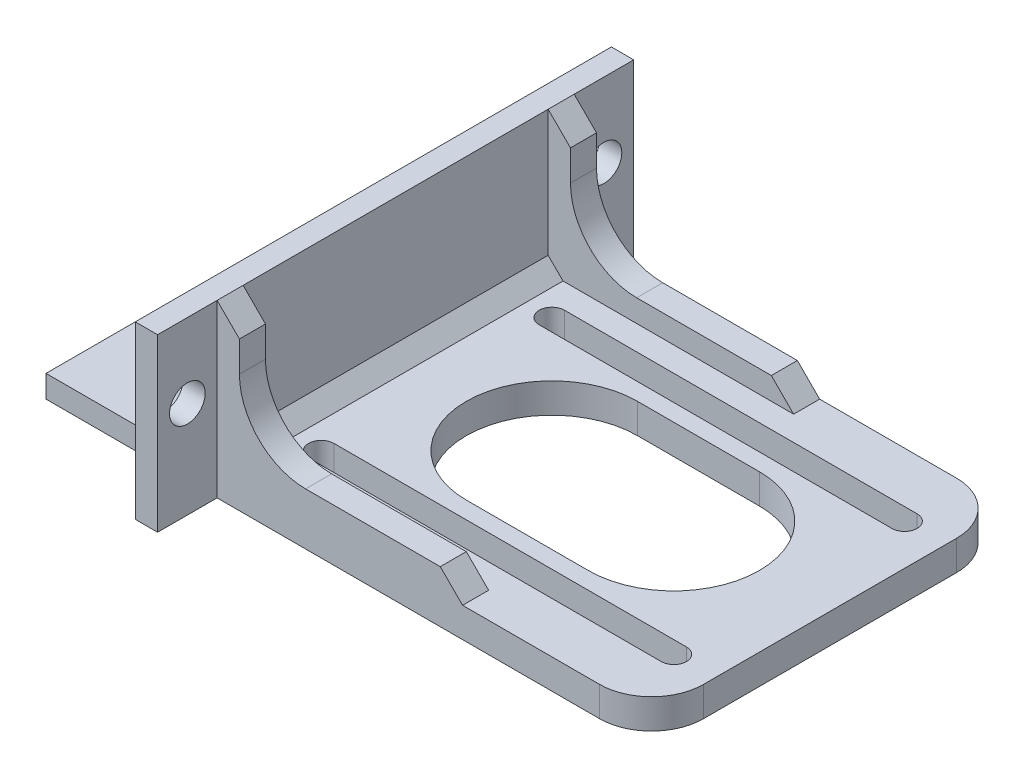
from build123d import *
from OCP.BRepFilletAPI import BRepFilletAPI_MakeChamfer

# Parameters (mm, degrees)
EXTRUDE_1_DEPTH     = 48
SKETCH_3_R          = 2.4
CUT_EXTRUDE_2_DEPTH = 89.328704281
CUT_EXTRUDE_3_REACH = 90.108
CHAMFER_1_SIZE      = 0.2
FILLET_1_R          = 7
CUT_EXTRUDE_4_DEPTH = 88.011263639
FILLET_2_R          = 4
RIB_START           = -3.5
RIB_2_DEPTH         = 3.5
CHAMFER_2_SIZE      = 0.8
CHAMFER_2_SIZE2     = 0.291176187
CHAMFER_3_SIZE      = 0.8
CHAMFER_3_SIZE2     = 0.291176187
CHAMFER_4_SIZE      = 2
SKETCH_21_W         = 8.512208597
SKETCH_21_H         = 13.260826712
CUT_EXTRUDE_5_DEPTH = 88.011263639
SKETCH_22_W         = 4
SKETCH_22_H         = 5.7
EXTRUDE_4_DEPTH     = 48
SKETCH_23_W         = 3
SKETCH_23_H         = 23
EXTRUDE_5_DEPTH     = 8
SKETCH_25_R         = 2.4
CUT_EXTRUDE_6_DEPTH = 85.112781431


# Read off the part's stored shape, not the designer's step: 筋2
with BuildPart() as part:
    # 草图1 → 凸台-拉伸1 (new body)
    with BuildSketch(Plane.XY):
        Polygon((-10, -10), (-10, -13), (71.4, -13), (71.4, -9), (13, -9), (13, 10), (10, 10), (10, 2.95), (8, 2.95), (8, 4.75), (6.8, 4.75), (6, 3.95), (6, -3.95), (6.8, -4.75), (8, -4.75), (8, -2.95), (10, -2.95), (10, -10), align=None)
    extrude(amount=EXTRUDE_1_DEPTH)

    # 草图3 → 切除-拉伸2 (cut, through all)
    with BuildSketch(Plane(origin=(0, -10, 0), x_dir=(1, 0, 0), z_dir=(0, 1, 0))):
        with Locations(Location((0, -24, 0), (0, 0, 270))):
            Circle(SKETCH_3_R)
    extrude(amount=-CUT_EXTRUDE_2_DEPTH, mode=Mode.SUBTRACT)

    # 草图4 → 切除-拉伸3 (cut, up to next)
    with BuildSketch(Plane(origin=(0, -9, 0), x_dir=(1, 0, 0), z_dir=(0, 1, 0)), mode=Mode.PRIVATE) as cut_extrude_3_sk1:
        with BuildLine():
            Line((18.5, -6.8), (65.9, -6.8))
            ThreePointArc((65.9, -6.8), (67.6, -8.5), (65.9, -10.2))
            Line((65.9, -10.2), (18.5, -10.2))
            ThreePointArc((18.5, -10.2), (16.8, -8.5), (18.5, -6.8))
        make_face()
    cut_extrude_3_tool1 = extrude(cut_extrude_3_sk1.sketch, amount=-CUT_EXTRUDE_3_REACH, mode=Mode.PRIVATE) & part.part
    # 草图4 → 切除-拉伸3 (cut, up to next)
    with BuildSketch(Plane(origin=(0, -9, 0), x_dir=(1, 0, 0), z_dir=(0, 1, 0)), mode=Mode.PRIVATE) as cut_extrude_3_sk2:
        with BuildLine():
            Line((18.5, -37.8), (65.9, -37.8))
            ThreePointArc((65.9, -37.8), (67.6, -39.5), (65.9, -41.2))
            Line((65.9, -41.2), (18.5, -41.2))
            ThreePointArc((18.5, -41.2), (16.8, -39.5), (18.5, -37.8))
        make_face()
    cut_extrude_3_tool2 = extrude(cut_extrude_3_sk2.sketch, amount=-CUT_EXTRUDE_3_REACH, mode=Mode.PRIVATE) & part.part
    # 草图4 → 切除-拉伸3 (cut, up to next)
    with BuildSketch(Plane(origin=(0, -9, 0), x_dir=(1, 0, 0), z_dir=(0, 1, 0)), mode=Mode.PRIVATE) as cut_extrude_3_sk3:
        with BuildLine():
            Line((34, -12.5), (50.4, -12.5))
            ThreePointArc((50.4, -12.5), (61.9, -24), (50.4, -35.5))
            Line((50.4, -35.5), (34, -35.5))
            ThreePointArc((34, -35.5), (22.5, -24), (34, -12.5))
        make_face()
    cut_extrude_3_tool3 = extrude(cut_extrude_3_sk3.sketch, amount=-CUT_EXTRUDE_3_REACH, mode=Mode.PRIVATE) & part.part
    add(cut_extrude_3_tool1.solids().sort_by_distance((42.2, -9, 8.5))[0], mode=Mode.SUBTRACT)
    add(cut_extrude_3_tool2.solids().sort_by_distance((42.2, -9, 39.5))[0], mode=Mode.SUBTRACT)
    add(cut_extrude_3_tool3.solids().sort_by_distance((42.2, -9, 24))[0], mode=Mode.SUBTRACT)

    # 倒角1
    chamfer_1_edges = [part.edges().sort_by_distance(p)[0] for p in [
        (8, -2.95, 24),
        (8, -4.75, 24),
        (8, 4.75, 24),
        (8, 2.95, 24),
    ]]
    chamfer(chamfer_1_edges, length=CHAMFER_1_SIZE)

    # 圆角1
    fillet_1_edges = [part.edges().sort_by_distance(p)[0] for p in [
        (71.4, -11, 48),
        (71.4, -11, 0),
    ]]
    fillet(fillet_1_edges, radius=FILLET_1_R)

    # 草图11 → 切除-拉伸4 (cut, through all)
    with BuildSketch(Plane(origin=(0, 0, 0), x_dir=(-1, 0, 0), z_dir=(0, 0, -1))):
        Polygon((-10, -2.65), (-6, 0.706398525), (-6, -6.71507999), (-10, -6.71507999), align=None)
    extrude(amount=-CUT_EXTRUDE_4_DEPTH, mode=Mode.SUBTRACT)

    # 圆角2
    fillet_2_edges = [part.edges().sort_by_distance(p)[0] for p in [
        (6, 0.706398525, 24),
    ]]
    fillet(fillet_2_edges, radius=FILLET_2_R)

    # 筋2 outline → 筋2 (add)
    with BuildSketch(Plane.XY.offset(48).offset(RIB_START)):
        with BuildLine():
            Line((13, -9), (46, -9))
            Line((46, -9), (43, -6))
            Line((43, -6), (24.9, -6))
            ThreePointArc((24.9, -6), (18.606749647, -3.393250353), (16, 2.9))
            Line((16, 2.9), (16, 7))
            Line((16, 7), (13, 10))
            Line((13, 10), (13, -9))
        make_face()
    rib_2 = extrude(amount=RIB_2_DEPTH)

    # 镜向1: 筋2 across plane
    add(rib_2.mirror(Plane.XY.offset(24)))

    # 倒角2: one chamfer whose edges measure the first distance from different faces: ONE call of the kernel's chamfer builder (chamfer() names one face for all edges)
    chamfer_2_edges_1 = [part.edges().sort_by_distance(p)[0] for p in [
        (9.1, 2.95, 48),
    ]]
    chamfer_2_side_1 = [part.faces().sort_by_distance(p)[0] for p in [
        (9.1, 2.95, 24),
    ]]
    chamfer_2_edges_2 = [part.edges().sort_by_distance(p)[0] for p in [
        (8, 3.85, 48),
    ]]
    chamfer_2_side_2 = [part.faces().sort_by_distance(p)[0] for p in [
        (8, 3.85, 24),
    ]]
    chamfer_2_edges_3 = [part.edges().sort_by_distance(p)[0] for p in [
        (7.3, 4.75, 48),
    ]]
    chamfer_2_side_3 = [part.faces().sort_by_distance(p)[0] for p in [
        (7.3, 4.75, 24),
    ]]
    chamfer_2_edges_4 = [part.edges().sort_by_distance(p)[0] for p in [
        (7.9, 4.65, 48),
    ]]
    chamfer_2_side_4 = [part.faces().sort_by_distance(p)[0] for p in [
        (7.9, 4.65, 24),
    ]]
    chamfer_2_edges_5 = [part.edges().sort_by_distance(p)[0] for p in [
        (8.1, 3.05, 48),
    ]]
    chamfer_2_side_5 = [part.faces().sort_by_distance(p)[0] for p in [
        (8.1, 3.05, 24),
    ]]
    chamfer_2_edges_6 = [part.edges().sort_by_distance(p)[0] for p in [
        (8.714424781, -1.571274308, 48),
    ]]
    chamfer_2_side_6 = [part.faces().sort_by_distance(p)[0] for p in [
        (8.714424781, -1.571274308, 24),
    ]]
    chamfer_2_edges_7 = [part.edges().sort_by_distance(p)[0] for p in [
        (6.374768852, 0.88115611, 48),
    ]]
    chamfer_2_side_7 = [part.faces().sort_by_distance(p)[0] for p in [
        (6.374768852, 0.88115611, 24),
    ]]
    chamfer_2_edges_8 = [part.edges().sort_by_distance(p)[0] for p in [
        (6.4, 4.35, 48),
    ]]
    chamfer_2_side_8 = [part.faces().sort_by_distance(p)[0] for p in [
        (6.4, 4.35, 24),
    ]]
    chamfer_2_edges_9 = [part.edges().sort_by_distance(p)[0] for p in [
        (6, 3.260814579, 48),
    ]]
    chamfer_2_side_9 = [part.faces().sort_by_distance(p)[0] for p in [
        (6, 3.260814579, 24),
    ]]
    chamfer_2 = BRepFilletAPI_MakeChamfer(part.part.solid().wrapped)
    for e in chamfer_2_edges_1:
        chamfer_2.Add(CHAMFER_2_SIZE, CHAMFER_2_SIZE2, e.wrapped, chamfer_2_side_1[0].wrapped)  # the first distance lies on this face
    for e in chamfer_2_edges_2:
        chamfer_2.Add(CHAMFER_2_SIZE, CHAMFER_2_SIZE2, e.wrapped, chamfer_2_side_2[0].wrapped)  # the first distance lies on this face
    for e in chamfer_2_edges_3:
        chamfer_2.Add(CHAMFER_2_SIZE, CHAMFER_2_SIZE2, e.wrapped, chamfer_2_side_3[0].wrapped)  # the first distance lies on this face
    for e in chamfer_2_edges_4:
        chamfer_2.Add(CHAMFER_2_SIZE, CHAMFER_2_SIZE2, e.wrapped, chamfer_2_side_4[0].wrapped)  # the first distance lies on this face
    for e in chamfer_2_edges_5:
        chamfer_2.Add(CHAMFER_2_SIZE, CHAMFER_2_SIZE2, e.wrapped, chamfer_2_side_5[0].wrapped)  # the first distance lies on this face
    for e in chamfer_2_edges_6:
        chamfer_2.Add(CHAMFER_2_SIZE, CHAMFER_2_SIZE2, e.wrapped, chamfer_2_side_6[0].wrapped)  # the first distance lies on this face
    for e in chamfer_2_edges_7:
        chamfer_2.Add(CHAMFER_2_SIZE, CHAMFER_2_SIZE2, e.wrapped, chamfer_2_side_7[0].wrapped)  # the first distance lies on this face
    for e in chamfer_2_edges_8:
        chamfer_2.Add(CHAMFER_2_SIZE, CHAMFER_2_SIZE2, e.wrapped, chamfer_2_side_8[0].wrapped)  # the first distance lies on this face
    for e in chamfer_2_edges_9:
        chamfer_2.Add(CHAMFER_2_SIZE, CHAMFER_2_SIZE2, e.wrapped, chamfer_2_side_9[0].wrapped)  # the first distance lies on this face
    add(Compound.cast(chamfer_2.Shape()), mode=Mode.REPLACE)

    # 倒角3: one chamfer whose edges measure the first distance from different faces: ONE call of the kernel's chamfer builder (chamfer() names one face for all edges)
    chamfer_3_edges_1 = [part.edges().sort_by_distance(p)[0] for p in [
        (7.3, 4.75, 0),
    ]]
    chamfer_3_side_1 = [part.faces().sort_by_distance(p)[0] for p in [
        (7.3, 4.75, 23.6),
    ]]
    chamfer_3_edges_2 = [part.edges().sort_by_distance(p)[0] for p in [
        (8, 3.85, 0),
    ]]
    chamfer_3_side_2 = [part.faces().sort_by_distance(p)[0] for p in [
        (8, 3.85, 23.6),
    ]]
    chamfer_3_edges_3 = [part.edges().sort_by_distance(p)[0] for p in [
        (7.9, 4.65, 0),
    ]]
    chamfer_3_side_3 = [part.faces().sort_by_distance(p)[0] for p in [
        (7.9, 4.65, 23.6),
    ]]
    chamfer_3_edges_4 = [part.edges().sort_by_distance(p)[0] for p in [
        (8.1, 3.05, 0),
    ]]
    chamfer_3_side_4 = [part.faces().sort_by_distance(p)[0] for p in [
        (8.1, 3.05, 23.6),
    ]]
    chamfer_3_edges_5 = [part.edges().sort_by_distance(p)[0] for p in [
        (6, 3.260814579, 0),
    ]]
    chamfer_3_side_5 = [part.faces().sort_by_distance(p)[0] for p in [
        (6, 3.260814579, 23.6),
    ]]
    chamfer_3_edges_6 = [part.edges().sort_by_distance(p)[0] for p in [
        (6.4, 4.35, 0),
    ]]
    chamfer_3_side_6 = [part.faces().sort_by_distance(p)[0] for p in [
        (6.4, 4.35, 23.6),
    ]]
    chamfer_3_edges_7 = [part.edges().sort_by_distance(p)[0] for p in [
        (9.1, 2.95, 0),
    ]]
    chamfer_3_side_7 = [part.faces().sort_by_distance(p)[0] for p in [
        (9.1, 2.95, 23.6),
    ]]
    chamfer_3_edges_8 = [part.edges().sort_by_distance(p)[0] for p in [
        (8.714424781, -1.571274308, 0),
    ]]
    chamfer_3_side_8 = [part.faces().sort_by_distance(p)[0] for p in [
        (8.714424781, -1.571274308, 23.6),
    ]]
    chamfer_3_edges_9 = [part.edges().sort_by_distance(p)[0] for p in [
        (6.374768852, 0.88115611, 0),
    ]]
    chamfer_3_side_9 = [part.faces().sort_by_distance(p)[0] for p in [
        (6.374768852, 0.88115611, 23.6),
    ]]
    chamfer_3 = BRepFilletAPI_MakeChamfer(part.part.solid().wrapped)
    for e in chamfer_3_edges_1:
        chamfer_3.Add(CHAMFER_3_SIZE, CHAMFER_3_SIZE2, e.wrapped, chamfer_3_side_1[0].wrapped)  # the first distance lies on this face
    for e in chamfer_3_edges_2:
        chamfer_3.Add(CHAMFER_3_SIZE, CHAMFER_3_SIZE2, e.wrapped, chamfer_3_side_2[0].wrapped)  # the first distance lies on this face
    for e in chamfer_3_edges_3:
        chamfer_3.Add(CHAMFER_3_SIZE, CHAMFER_3_SIZE2, e.wrapped, chamfer_3_side_3[0].wrapped)  # the first distance lies on this face
    for e in chamfer_3_edges_4:
        chamfer_3.Add(CHAMFER_3_SIZE, CHAMFER_3_SIZE2, e.wrapped, chamfer_3_side_4[0].wrapped)  # the first distance lies on this face
    for e in chamfer_3_edges_5:
        chamfer_3.Add(CHAMFER_3_SIZE, CHAMFER_3_SIZE2, e.wrapped, chamfer_3_side_5[0].wrapped)  # the first distance lies on this face
    for e in chamfer_3_edges_6:
        chamfer_3.Add(CHAMFER_3_SIZE, CHAMFER_3_SIZE2, e.wrapped, chamfer_3_side_6[0].wrapped)  # the first distance lies on this face
    for e in chamfer_3_edges_7:
        chamfer_3.Add(CHAMFER_3_SIZE, CHAMFER_3_SIZE2, e.wrapped, chamfer_3_side_7[0].wrapped)  # the first distance lies on this face
    for e in chamfer_3_edges_8:
        chamfer_3.Add(CHAMFER_3_SIZE, CHAMFER_3_SIZE2, e.wrapped, chamfer_3_side_8[0].wrapped)  # the first distance lies on this face
    for e in chamfer_3_edges_9:
        chamfer_3.Add(CHAMFER_3_SIZE, CHAMFER_3_SIZE2, e.wrapped, chamfer_3_side_9[0].wrapped)  # the first distance lies on this face
    add(Compound.cast(chamfer_3.Shape()), mode=Mode.REPLACE)

    # 倒角4
    chamfer_4_edges = [part.edges().sort_by_distance(p)[0] for p in [
        (13, -9, 24),
    ]]
    chamfer(chamfer_4_edges, length=CHAMFER_4_SIZE)

    # 草图21 → 切除-拉伸5 (cut, through all)
    with BuildSketch(Plane.XY.offset(48)):
        with Locations((5.743895701, 1.572706777)):
            Rectangle(SKETCH_21_W, SKETCH_21_H)
    extrude(amount=-CUT_EXTRUDE_5_DEPTH, mode=Mode.SUBTRACT)

    # 草图22 → 凸台-拉伸4 (add)
    with BuildSketch(Plane.XY.offset(48)):
        with Locations((8, 0.25)):
            Rectangle(SKETCH_22_W, SKETCH_22_H)
    extrude(amount=-EXTRUDE_4_DEPTH)

    # 草图23 → 凸台-拉伸5 (add)
    with BuildSketch(Plane.XY.offset(48)):
        with Locations((11.5, -1.5)):
            Rectangle(SKETCH_23_W, SKETCH_23_H)
    extrude_5 = extrude(amount=EXTRUDE_5_DEPTH)

    # 草图25 → 切除-拉伸6 (cut, through all)
    with BuildSketch(Plane.ZY.offset(-10)):
        with Locations((52, 0)):
            Circle(SKETCH_25_R)
    cut_extrude_6 = extrude(amount=-CUT_EXTRUDE_6_DEPTH, mode=Mode.SUBTRACT)

    # 镜向2: 凸台-拉伸5, 切除-拉伸6 across plane
    add(extrude_5.mirror(Plane.XY.offset(24)))
    add(cut_extrude_6.mirror(Plane.XY.offset(24)), mode=Mode.SUBTRACT)


solid = part.part
